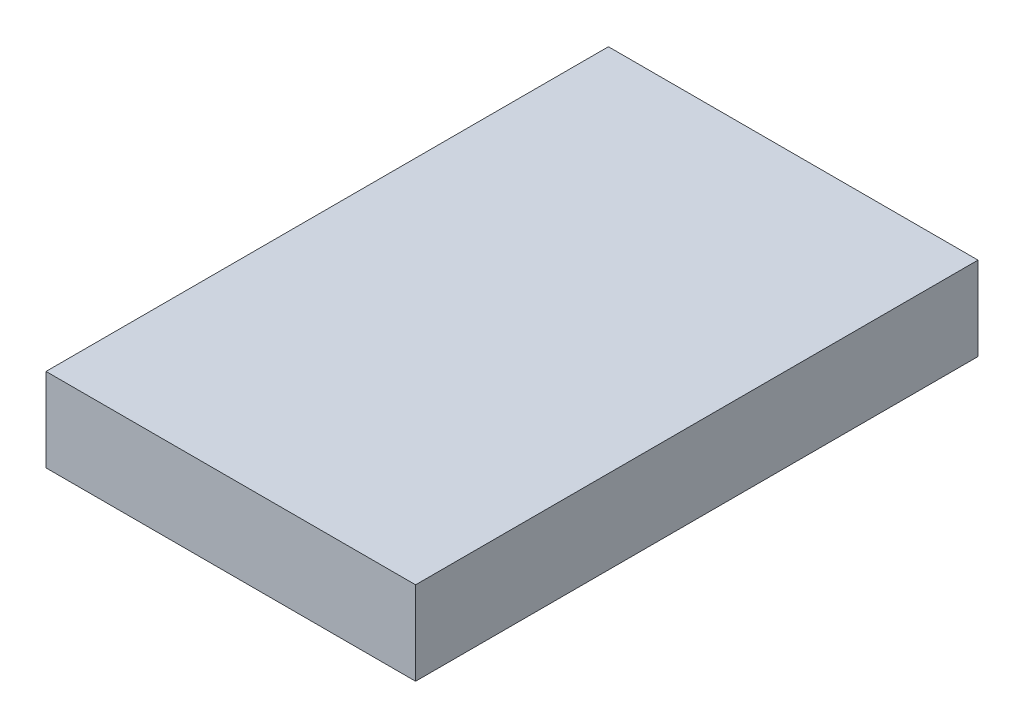
from build123d import *

# Parameters (mm, degrees)
SKETCH1_W           = 23
SKETCH1_H           = 35
BOSS_EXTRUDE1_DEPTH = 5.2


with BuildPart() as part:
    # Sketch1 → Boss-Extrude1 (new body)
    with BuildSketch(Plane(origin=(0, 0, 0), x_dir=(1, 0, 0), z_dir=(0, 1, 0))):
        Rectangle(SKETCH1_W, SKETCH1_H)
    extrude(amount=BOSS_EXTRUDE1_DEPTH)


solid = part.part
